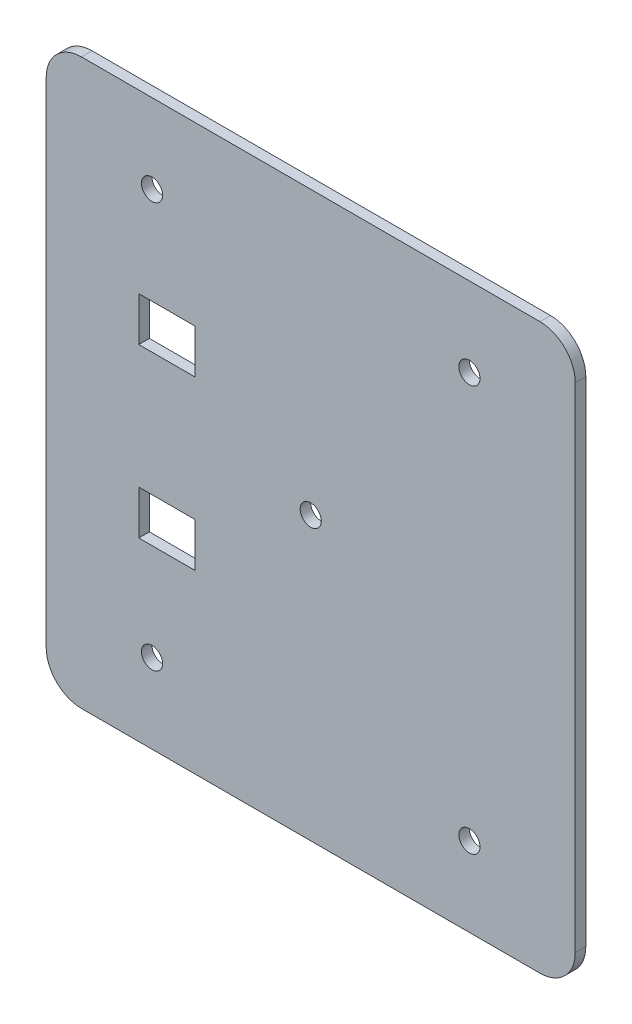
from build123d import *

# Parameters (mm, degrees)
SKETCH1_R           = 6
SKETCH1_W           = 32
SKETCH1_H           = 25
BOSS_EXTRUDE1_DEPTH = 6


with BuildPart() as part:
    # Sketch1 → Boss-Extrude1 (new body)
    with BuildSketch(Plane.XY):
        with BuildLine():
            ThreePointArc((205, -102.5), (219.142135624, -96.642135624), (225, -82.5))
            Line((225, -82.5), (225, 197.5))
            ThreePointArc((225, 197.5), (219.142135624, 211.642135624), (205, 217.5))
            Line((205, 217.5), (-55, 217.5))
            ThreePointArc((-55, 217.5), (-69.142135624, 211.642135624), (-75, 197.5))
            Line((-75, 197.5), (-75, -82.5))
            ThreePointArc((-75, -82.5), (-69.142135624, -96.642135624), (-55, -102.5))
            Line((-55, -102.5), (205, -102.5))
        make_face()
        Polygon((-22.5, -2.5), (-22.5, 22.5), (0, 22.5), (9.5, 22.5), (9.5, -2.5), align=None, mode=Mode.SUBTRACT)
        with Locations((-15, -57.5)):
            Circle(SKETCH1_R, mode=Mode.SUBTRACT)
        with Locations((-15, 172.5)):
            Circle(SKETCH1_R, mode=Mode.SUBTRACT)
        with Locations((75, 57.5)):
            Circle(SKETCH1_R, mode=Mode.SUBTRACT)
        with Locations((-6.5, 105)):
            Rectangle(SKETCH1_W, SKETCH1_H, mode=Mode.SUBTRACT)
        with Locations((165, 172.5)):
            Circle(SKETCH1_R, mode=Mode.SUBTRACT)
        with Locations((165, -57.5)):
            Circle(SKETCH1_R, mode=Mode.SUBTRACT)
    extrude(amount=BOSS_EXTRUDE1_DEPTH)


solid = part.part
